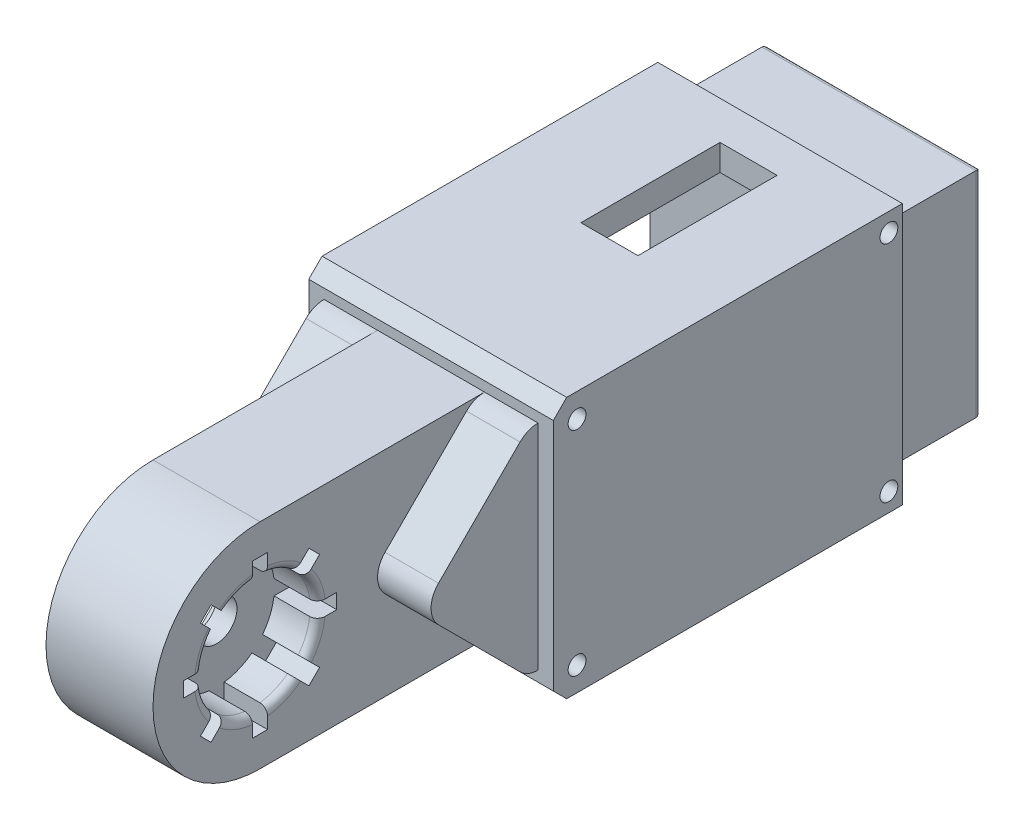
from build123d import *

# Parameters (mm, degrees)
SKETCH2_W                = 42
SKETCH2_H                = 42
BOSS_EXTRUDE1_DEPTH      = 89
SKETCH3_W                = 21
SKETCH3_H                = 42
BOSS_EXTRUDE2_DEPTH      = 42
BOSS_EXTRUDE3_DEPTH      = 21
SKETCH9_R                = 11.35
CUT_EXTRUDE2_DEPTH       = 8.5
CUT_EXTRUDE3_START       = -8.5
SKETCH11_R               = 11.35
CUT_EXTRUDE3_DEPTH       = 8.5
SKETCH12_R               = 3.975
CUT_EXTRUDE4_DEPTH       = 156.157984003
BOSS_EXTRUDE4_DEPTH      = 10.5
BOSS_EXTRUDE4_DEPTH_BACK = 31.5
FILLET1_R                = 5
FILLET2_R                = 5
FILLET3_R                = 5
FILLET4_R                = 5
FILLET5_R                = 5
FILLET6_R                = 5
FILLET7_R                = 1.5
FILLET8_R                = 1.5
SKETCH21_W               = 2.95860585
SKETCH21_H               = 4.417
CUT_EXTRUDE5_DEPTH       = 8.5
CIRPATTERN2_COUNT        = 8
MIRROR1_COPY_1_SKETCH_W  = 2.95860585
MIRROR1_COPY_1_SKETCH_H  = 4.417
MIRROR1_COPY_1_DEPTH     = 8.5
MIRROR1_COPY_2_SKETCH_W  = 2.95860585
MIRROR1_COPY_2_SKETCH_H  = 4.417
MIRROR1_COPY_2_DEPTH     = 8.5
MIRROR1_COPY_3_SKETCH_W  = 2.95860585
MIRROR1_COPY_3_SKETCH_H  = 4.417
MIRROR1_COPY_3_DEPTH     = 8.5
MIRROR1_COPY_4_SKETCH_W  = 2.95860585
MIRROR1_COPY_4_SKETCH_H  = 4.417
MIRROR1_COPY_4_DEPTH     = 8.5
MIRROR1_COPY_5_SKETCH_W  = 2.95860585
MIRROR1_COPY_5_SKETCH_H  = 4.417
MIRROR1_COPY_5_DEPTH     = 8.5
MIRROR1_COPY_6_SKETCH_W  = 2.95860585
MIRROR1_COPY_6_SKETCH_H  = 4.417
MIRROR1_COPY_6_DEPTH     = 8.5
MIRROR1_COPY_7_SKETCH_W  = 2.95860585
MIRROR1_COPY_7_SKETCH_H  = 4.417
MIRROR1_COPY_7_DEPTH     = 8.5
MIRROR1_COPY_8_SKETCH_W  = 2.95860585
MIRROR1_COPY_8_SKETCH_H  = 4.417
MIRROR1_COPY_8_DEPTH     = 8.5
SKETCH24_W               = 86.928932188
SKETCH24_H               = 4.545220174
SKETCH24_H_2             = 4.689106432
BOSS_EXTRUDE6_DEPTH      = 42
SKETCH25_W               = 68.5
SKETCH25_H               = 51.234326606
BOSS_EXTRUDE7_DEPTH      = 3
SKETCH28_W               = 68.5
SKETCH28_H               = 51.234326606
BOSS_EXTRUDE8_DEPTH      = 3
SKETCH30_W               = 62
SKETCH30_H               = 41.004326606
CUT_EXTRUDE6_DEPTH       = 45
SKETCH31_W               = 18.428932188
SKETCH31_H               = 4.615
CUT_EXTRUDE7_DEPTH       = 161.589321529
CHAMFER1_SIZE            = 1.5
SKETCH32_W               = 30
SKETCH32_H               = 30
CUT_EXTRUDE8_DEPTH       = 16.8
SKETCH33_R               = 5
CUT_EXTRUDE9_DEPTH       = 16.8
CUT_EXTRUDE10_DEPTH      = 162.455660134
CHAMFER2_SIZE            = 6
CHAMFER3_SIZE            = 6
CHAMFER4_SIZE            = 6
CHAMFER5_SIZE            = 6
SKETCH35_R               = 1.75
CUT_EXTRUDE11_DEPTH      = 162.455660134
SKETCH38_W               = 11.2
SKETCH38_H               = 27.3
CUT_EXTRUDE12_DEPTH      = 163.188027372
FILLET9_R                = 1
FILLET10_R               = 1


with BuildPart() as part:
    # Sketch2 → Boss-Extrude1 (new body)
    with BuildSketch(Plane.XY):
        Rectangle(SKETCH2_W, SKETCH2_H)
    extrude(amount=BOSS_EXTRUDE1_DEPTH)

    # Sketch3 → Boss-Extrude2 (add)
    with BuildSketch(Plane.XY.offset(89)):
        Rectangle(SKETCH3_W, SKETCH3_H)
    extrude(amount=BOSS_EXTRUDE2_DEPTH)

    # Sketch8 → Boss-Extrude3 (add)
    with BuildSketch(Plane.ZY.offset(10.5)):
        with BuildLine():
            Line((131, 21), (131, -21))
            ThreePointArc((131, -21), (152, 0), (131, 21))
        make_face()
    extrude(amount=-BOSS_EXTRUDE3_DEPTH)

    # Sketch9 → Cut-Extrude2 (cut)
    with BuildSketch(Plane.ZY.offset(10.5)):
        with Locations((131, 0)):
            Circle(SKETCH9_R)
    extrude(amount=-CUT_EXTRUDE2_DEPTH, mode=Mode.SUBTRACT)

    # Sketch11 → Cut-Extrude3 (cut)
    with BuildSketch(Plane(origin=(10.5, 0, 0), x_dir=(0, 0, -1), z_dir=(1, 0, 0)).offset(CUT_EXTRUDE3_START)):
        with Locations((-131, 0)):
            Circle(SKETCH11_R)
    extrude(amount=CUT_EXTRUDE3_DEPTH, mode=Mode.SUBTRACT)

    # Sketch12 → Cut-Extrude4 (cut, through all)
    with BuildSketch(Plane.ZY.offset(2)):
        with Locations((131, 0)):
            Circle(SKETCH12_R)
    extrude(amount=-CUT_EXTRUDE4_DEPTH, mode=Mode.SUBTRACT)

    # Sketch20 → Boss-Extrude4 (add, two sides: drawn at the far end of the back side and taken through both)
    with BuildSketch(Plane.ZY.offset(10.5).offset(-BOSS_EXTRUDE4_DEPTH_BACK)):
        Polygon((89, -21), (110, 0), (89, 21), align=None)
    extrude(amount=BOSS_EXTRUDE4_DEPTH + BOSS_EXTRUDE4_DEPTH_BACK)

    # Fillet1
    fillet1_edges = [part.edges().sort_by_distance(p)[0] for p in [
        (15.75, 0, 110),
    ]]
    fillet(fillet1_edges, radius=FILLET1_R)

    # Fillet2
    fillet2_edges = [part.edges().sort_by_distance(p)[0] for p in [
        (-15.75, 0, 110),
    ]]
    fillet(fillet2_edges, radius=FILLET2_R)

    # Fillet3
    fillet3_edges = [part.edges().sort_by_distance(p)[0] for p in [
        (-15.75, -21, 89),
    ]]
    fillet(fillet3_edges, radius=FILLET3_R)

    # Fillet4
    fillet4_edges = [part.edges().sort_by_distance(p)[0] for p in [
        (-15.75, 21, 89),
    ]]
    fillet(fillet4_edges, radius=FILLET4_R)

    # Fillet5
    fillet5_edges = [part.edges().sort_by_distance(p)[0] for p in [
        (15.75, -21, 89),
    ]]
    fillet(fillet5_edges, radius=FILLET5_R)

    # Fillet6
    fillet6_edges = [part.edges().sort_by_distance(p)[0] for p in [
        (15.75, 21, 89),
    ]]
    fillet(fillet6_edges, radius=FILLET6_R)

    # Fillet7
    fillet7_edges = [part.edges().sort_by_distance(p)[0] for p in [
        (-10.5, 0, 119.65),
    ]]
    fillet(fillet7_edges, radius=FILLET7_R)

    # Fillet8
    fillet8_edges = [part.edges().sort_by_distance(p)[0] for p in [
        (10.5, 0, 142.35),
    ]]
    fillet(fillet8_edges, radius=FILLET8_R)

    # Sketch21 → Cut-Extrude5 (cut)
    with BuildSketch(Plane.ZY.offset(10.5)):
        with Locations((131, 12.85)):
            Rectangle(SKETCH21_W, SKETCH21_H)
    cut_extrude5 = extrude(amount=-CUT_EXTRUDE5_DEPTH, mode=Mode.SUBTRACT)

    # CirPattern2: Cut-Extrude5 ×8 about axis
    cirpattern2_axis = Axis((-9, 0, 131), (-1, 0, 0))
    for i in range(1, CIRPATTERN2_COUNT):
        add(cut_extrude5.rotate(cirpattern2_axis, i * 360 / CIRPATTERN2_COUNT), mode=Mode.SUBTRACT)

    # Mirror1 copy 1 sketch → Mirror1 copy 1 (cut)
    with BuildSketch(Plane(origin=(10.5, -92.630988335, 38.369011665), x_dir=(0, 0.7071067811865475, 0.7071067811865476), z_dir=(1, 0, 0))):
        with Locations((131, -12.85)):
            Rectangle(MIRROR1_COPY_1_SKETCH_W, MIRROR1_COPY_1_SKETCH_H)
    extrude(amount=-MIRROR1_COPY_1_DEPTH, mode=Mode.SUBTRACT)

    # Mirror1 copy 2 sketch → Mirror1 copy 2 (cut)
    with BuildSketch(Plane(origin=(10.5, -131, 131), x_dir=(0, 1, 0), z_dir=(1, 0, 0))):
        with Locations((131, -12.85)):
            Rectangle(MIRROR1_COPY_2_SKETCH_W, MIRROR1_COPY_2_SKETCH_H)
    extrude(amount=-MIRROR1_COPY_2_DEPTH, mode=Mode.SUBTRACT)

    # Mirror1 copy 3 sketch → Mirror1 copy 3 (cut)
    with BuildSketch(Plane(origin=(10.5, -92.630988335, 223.630988335), x_dir=(0, 0.7071067811865476, -0.7071067811865475), z_dir=(1, 0, 0))):
        with Locations((131, -12.85)):
            Rectangle(MIRROR1_COPY_3_SKETCH_W, MIRROR1_COPY_3_SKETCH_H)
    extrude(amount=-MIRROR1_COPY_3_DEPTH, mode=Mode.SUBTRACT)

    # Mirror1 copy 4 sketch → Mirror1 copy 4 (cut)
    with BuildSketch(Plane(origin=(10.5, 0, 262), x_dir=(0, 0, -1), z_dir=(1, 0, 0))):
        with Locations((131, -12.85)):
            Rectangle(MIRROR1_COPY_4_SKETCH_W, MIRROR1_COPY_4_SKETCH_H)
    extrude(amount=-MIRROR1_COPY_4_DEPTH, mode=Mode.SUBTRACT)

    # Mirror1 copy 5 sketch → Mirror1 copy 5 (cut)
    with BuildSketch(Plane(origin=(10.5, 92.630988335, 223.630988335), x_dir=(0, -0.7071067811865475, -0.7071067811865477), z_dir=(1, 0, 0))):
        with Locations((131, -12.85)):
            Rectangle(MIRROR1_COPY_5_SKETCH_W, MIRROR1_COPY_5_SKETCH_H)
    extrude(amount=-MIRROR1_COPY_5_DEPTH, mode=Mode.SUBTRACT)

    # Mirror1 copy 6 sketch → Mirror1 copy 6 (cut)
    with BuildSketch(Plane(origin=(10.5, 131, 131), x_dir=(0, -1, 0), z_dir=(1, 0, 0))):
        with Locations((131, -12.85)):
            Rectangle(MIRROR1_COPY_6_SKETCH_W, MIRROR1_COPY_6_SKETCH_H)
    extrude(amount=-MIRROR1_COPY_6_DEPTH, mode=Mode.SUBTRACT)

    # Mirror1 copy 7 sketch → Mirror1 copy 7 (cut)
    with BuildSketch(Plane(origin=(10.5, 92.630988335, 38.369011665), x_dir=(0, -0.7071067811865477, 0.7071067811865474), z_dir=(1, 0, 0))):
        with Locations((131, -12.85)):
            Rectangle(MIRROR1_COPY_7_SKETCH_W, MIRROR1_COPY_7_SKETCH_H)
    extrude(amount=-MIRROR1_COPY_7_DEPTH, mode=Mode.SUBTRACT)

    # Mirror1 copy 8 sketch → Mirror1 copy 8 (cut)
    with BuildSketch(Plane(origin=(10.5, 0, 0), x_dir=(0, 0, 1), z_dir=(1, 0, 0))):
        with Locations((131, -12.85)):
            Rectangle(MIRROR1_COPY_8_SKETCH_W, MIRROR1_COPY_8_SKETCH_H)
    extrude(amount=-MIRROR1_COPY_8_DEPTH, mode=Mode.SUBTRACT)

    # Sketch24 → Boss-Extrude6 (add)
    with BuildSketch(Plane(origin=(21, 0, 0), x_dir=(0, 0, -1), z_dir=(1, 0, 0))):
        with Locations((-43.464466094, 23.272610087)):
            Rectangle(SKETCH24_W, SKETCH24_H)
        with Locations((-43.464466094, -23.344553216)):
            Rectangle(SKETCH24_W, SKETCH24_H_2)
    extrude(amount=-BOSS_EXTRUDE6_DEPTH)

    # Sketch25 → Boss-Extrude7 (add)
    with BuildSketch(Plane(origin=(21, 0, 0), x_dir=(0, 0, -1), z_dir=(1, 0, 0))):
        with Locations((-52.678932188, -0.071943129)):
            Rectangle(SKETCH25_W, SKETCH25_H)
    extrude(amount=BOSS_EXTRUDE7_DEPTH)

    # Sketch28 → Boss-Extrude8 (add)
    with BuildSketch(Plane.ZY.offset(21)):
        with Locations((52.678932188, -0.071943129)):
            Rectangle(SKETCH28_W, SKETCH28_H)
    extrude(amount=BOSS_EXTRUDE8_DEPTH)

    # Sketch30 → Cut-Extrude6 (cut)
    with BuildSketch(Plane.ZY.offset(24)):
        with Locations((50.928932188, -0.071943129)):
            Rectangle(SKETCH30_W, SKETCH30_H)
    extrude(amount=-CUT_EXTRUDE6_DEPTH, mode=Mode.SUBTRACT)

    # Sketch31 → Cut-Extrude7 (cut, through all)
    with BuildSketch(Plane(origin=(21, 0, 0), x_dir=(0, 0, -1), z_dir=(1, 0, 0))):
        with Locations((-9.214466094, -23.381606432)):
            Rectangle(SKETCH31_W, SKETCH31_H)
        with Locations((-9.214466094, 23.237720174)):
            Rectangle(SKETCH31_W, SKETCH31_H)
    extrude(amount=-CUT_EXTRUDE7_DEPTH, mode=Mode.SUBTRACT)

    # Chamfer1
    chamfer1_edges = [part.edges().sort_by_distance(p)[0] for p in [
        (0, 20.930220174, 18.428932188),
        (21, -0.071943129, 18.428932188),
        (0, -21.074106432, 18.428932188),
        (-21, -0.071943129, 18.428932188),
    ]]
    chamfer(chamfer1_edges, length=CHAMFER1_SIZE)

    # Sketch32 → Cut-Extrude8 (cut)
    with BuildSketch(Plane(origin=(0, 0, 0), x_dir=(-1, 0, 0), z_dir=(0, 0, -1))):
        Rectangle(SKETCH32_W, SKETCH32_H)
    extrude(amount=-CUT_EXTRUDE8_DEPTH, mode=Mode.SUBTRACT)

    # Sketch33 → Cut-Extrude9 (cut)
    with BuildSketch(Plane.XY.offset(19.928932188)):
        Circle(SKETCH33_R)
    extrude(amount=-CUT_EXTRUDE9_DEPTH, mode=Mode.SUBTRACT)

    # Sketch34 → Cut-Extrude10 (cut, through all)
    with BuildSketch(Plane.ZY.offset(24)):
        Polygon((88.330412389, -21.669587611), (88.330412389, -28.222069099), (81.777930901, -28.222069099), align=None)
        Polygon((88.330412389, 28.078182842), (81.777930901, 28.078182842), (88.330412389, 21.525701354), align=None)
    extrude(amount=-CUT_EXTRUDE10_DEPTH, mode=Mode.SUBTRACT)

    # Chamfer2
    chamfer2_edges = [part.edges().sort_by_distance(p)[0] for p in [
        (-1.5, 20.430220174, 81.928932188),
    ]]
    chamfer(chamfer2_edges, length=CHAMFER2_SIZE)

    # Chamfer3
    chamfer3_edges = [part.edges().sort_by_distance(p)[0] for p in [
        (-1.5, -20.574106432, 81.928932188),
    ]]
    chamfer(chamfer3_edges, length=CHAMFER3_SIZE)

    # Chamfer4
    chamfer4_edges = [part.edges().sort_by_distance(p)[0] for p in [
        (-1.5, 20.430220174, 19.928932188),
    ]]
    chamfer(chamfer4_edges, length=CHAMFER4_SIZE)

    # Chamfer5
    chamfer5_edges = [part.edges().sort_by_distance(p)[0] for p in [
        (-1.5, -20.574106432, 19.928932188),
    ]]
    chamfer(chamfer5_edges, length=CHAMFER5_SIZE)

    # Sketch35 → Cut-Extrude11 (cut, through all)
    with BuildSketch(Plane.ZY.offset(24)):
        with Locations((21.074129387, 21.904762541)):
            Circle(SKETCH35_R)
        with Locations((82.274422533, 20.83321052)):
            Circle(SKETCH35_R)
        with Locations((82.274422533, -20.977096777)):
            Circle(SKETCH35_R)
        with Locations((21.073965823, -22.048529957)):
            Circle(SKETCH35_R)
    extrude(amount=-CUT_EXTRUDE11_DEPTH, mode=Mode.SUBTRACT)

    # Sketch38 → Cut-Extrude12 (cut, through all)
    with BuildSketch(Plane(origin=(0, -25.689106432, 0), x_dir=(-1, 0, 0), z_dir=(0, -1, 0))):
        with Locations((-1.30782555, -39.578932188)):
            Rectangle(SKETCH38_W, SKETCH38_H)
    extrude(amount=-CUT_EXTRUDE12_DEPTH, mode=Mode.SUBTRACT)

    # Fillet9
    fillet9_edges = [part.edges().sort_by_distance(p)[0] for p in [
        (21, -0.071943129, 0),
        (0, 20.930220174, 0),
        (0, -21.074106432, 0),
        (-21, -0.071943129, 0),
    ]]
    fillet(fillet9_edges, radius=FILLET9_R)

    # Fillet10
    fillet10_edges = [part.edges().sort_by_distance(p)[0] for p in [
        (0, 15, 0),
        (15, 0, 0),
        (0, -15, 0),
        (-15, 0, 0),
    ]]
    fillet(fillet10_edges, radius=FILLET10_R)


solid = part.part
